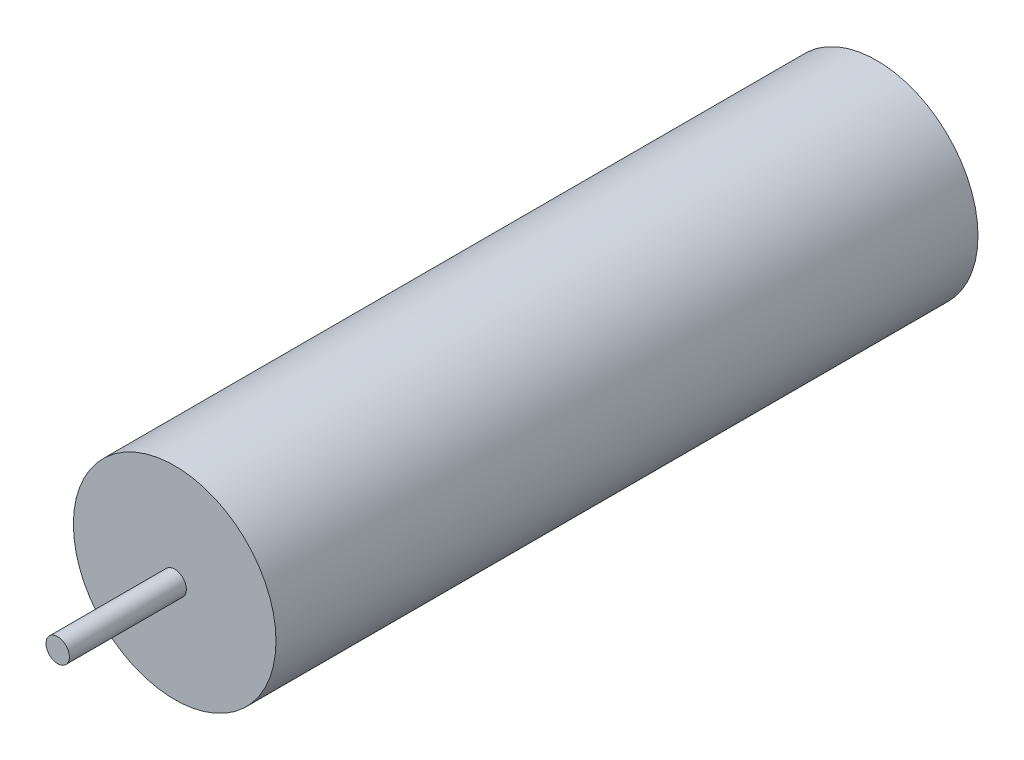
from build123d import *

# Parameters (mm, degrees)
SKETCH1_R           = 10.9982
BOSS_EXTRUDE1_DEPTH = 76.2
SKETCH2_R           = 1.27
BOSS_EXTRUDE2_DEPTH = 12.7


with BuildPart() as part:
    # Sketch1 → Boss-Extrude1 (new body)
    with BuildSketch(Plane.XY):
        with Locations((0, -25.4)):
            Circle(SKETCH1_R)
    extrude(amount=-BOSS_EXTRUDE1_DEPTH)

    # Sketch2 → Boss-Extrude2 (add)
    with BuildSketch(Plane.XY):
        with Locations((0, -25.4)):
            Circle(SKETCH2_R)
    extrude(amount=BOSS_EXTRUDE2_DEPTH)


solid = part.part
